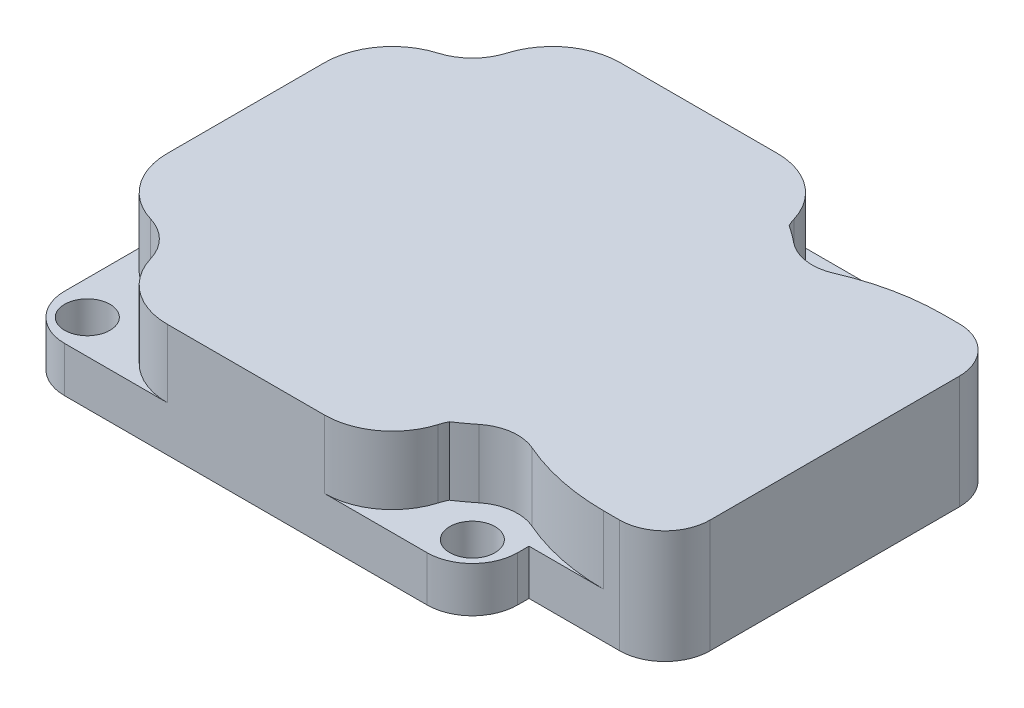
from build123d import *

# Parameters (mm, degrees)
BOSS_EXTRUDE1_DEPTH     = 5
SKETCH2_R               = 1
CUT_EXTRUDE1_DEPTH      = 15
SHELL1_DEPTH            = 3.5
SKETCH4_R               = 2.25
CUT_EXTRUDE2_DEPTH      = 3
FILLET2_R               = 3
BOSS_EXTRUDE2_DEPTH     = 5
CUT_EXTRUDE3_DEPTH      = 3.5
SKETCH8_W               = 3.515564437
SKETCH8_H               = 15
BOSS_EXTRUDE3_DEPTH     = 3
SKETCH9_R               = 2
CUT_EXTRUDE5_DEPTH      = 3
FILLET3_R               = 10
CUT_EXTRUDE7_DEPTH      = 3
CUT_EXTRUDE7_DEPTH_BACK = 1.5
BOSS_EXTRUDE4_START     = 3.5
BOSS_EXTRUDE4_DEPTH     = 3.5


with BuildPart() as part:
    # Sketch1 → Boss-Extrude1 (new body)
    with BuildSketch(Plane(origin=(0, 0, 0), x_dir=(1, 0, 0), z_dir=(0, 1, 0))):
        with BuildLine():
            Line((-8, 10), (8, 10))
            ThreePointArc((8, 10), (9.414213562, 9.414213562), (10, 8))
            Line((10, 8), (10, -8))
            ThreePointArc((10, -8), (9.414213562, -9.414213562), (8, -10))
            Line((8, -10), (-8, -10))
            ThreePointArc((-8, -10), (-9.414213562, -9.414213562), (-10, -8))
            Line((-10, -8), (-10, 8))
            ThreePointArc((-10, 8), (-9.414213562, 9.414213562), (-8, 10))
        make_face()
    extrude(amount=BOSS_EXTRUDE1_DEPTH)

    # Sketch2 → Cut-Extrude1 (cut)
    with BuildSketch(Plane.XZ):
        with Locations(Location((-8.5, 8.5, 0), (0, 0, 270))):
            Circle(SKETCH2_R)
        with Locations(Location((8.5, 8.5, 0), (0, 0, 270))):
            Circle(SKETCH2_R)
        with Locations(Location((8.5, -8.5, 0), (0, 0, 270))):
            Circle(SKETCH2_R)
        with Locations(Location((-8.5, -8.5, 0), (0, 0, 270))):
            Circle(SKETCH2_R)
    extrude(amount=-CUT_EXTRUDE1_DEPTH, mode=Mode.SUBTRACT)

    # Shell1: read off the stored shape, not the designer's step
    # Shell1 outline → Shell1 (cut)
    with BuildSketch(Plane(origin=(0, 0, 0), x_dir=(1, 0, 0), z_dir=(0, 1, 0))):
        with BuildLine():
            Line((6, 8.5), (-6, 8.5))
            ThreePointArc((-6, 8.5), (-6.732233047, 6.732233047), (-8.5, 6))
            Line((-8.5, 6), (-8.5, -6))
            ThreePointArc((-8.5, -6), (-6.732233047, -6.732233047), (-6, -8.5))
            Line((-6, -8.5), (6, -8.5))
            ThreePointArc((6, -8.5), (6.732233047, -6.732233047), (8.5, -6))
            Line((8.5, -6), (8.5, 6))
            ThreePointArc((8.5, 6), (6.732233047, 6.732233047), (6, 8.5))
        make_face()
    extrude(amount=SHELL1_DEPTH, mode=Mode.SUBTRACT)

    # Sketch4 → Cut-Extrude2 (cut)
    with BuildSketch(Plane(origin=(0, 5, 0), x_dir=(1, 0, 0), z_dir=(0, 1, 0))):
        with Locations((8.5, -8.5)):
            Circle(SKETCH4_R)
        with Locations((-8.5, -8.5)):
            Circle(SKETCH4_R)
        with Locations((-8.5, 8.5)):
            Circle(SKETCH4_R)
        with Locations((8.5, 8.5)):
            Circle(SKETCH4_R)
    extrude(amount=-CUT_EXTRUDE2_DEPTH, mode=Mode.SUBTRACT)

    # Fillet2
    fillet2_edges = [part.edges().sort_by_distance(p)[0] for p in [
        (6.822949017, 3.5, -10),
        (10, 3.5, -6.822949017),
        (-6.822949017, 3.5, -10),
        (-10, 3.5, -6.822949017),
        (-10, 3.5, 6.822949017),
        (-6.822949017, 3.5, 10),
        (6.822949017, 3.5, 10),
        (10, 3.5, 6.822949017),
    ]]
    fillet(fillet2_edges, radius=FILLET2_R)

    # Sketch5 → Boss-Extrude2 (add)
    with BuildSketch(Plane.XZ):
        with BuildLine():
            Line((10, 7.5), (14, 7.5))
            ThreePointArc((14, 7.5), (15.414213562, 6.914213562), (16, 5.5))
            Line((16, 5.5), (16, -5.5))
            ThreePointArc((16, -5.5), (15.414213562, -6.914213562), (14, -7.5))
            Line((14, -7.5), (10, -7.5))
            Line((10, -7.5), (10, 7.5))
        make_face()
    extrude(amount=-BOSS_EXTRUDE2_DEPTH)

    # Sketch6 → Cut-Extrude3 (cut)
    with BuildSketch(Plane.XZ):
        with BuildLine():
            Line((8.5, 5.5), (13, 5.5))
            ThreePointArc((13, 5.5), (14.060660172, 5.060660172), (14.5, 4))
            Line((14.5, 4), (14.5, -4))
            ThreePointArc((14.5, -4), (14.060660172, -5.060660172), (13, -5.5))
            Line((13, -5.5), (8.5, -5.5))
            Line((8.5, -5.5), (8.5, 5.5))
        make_face()
    extrude(amount=-CUT_EXTRUDE3_DEPTH, mode=Mode.SUBTRACT)

    # Sketch8 → Boss-Extrude3 (add)
    with BuildSketch(Plane(origin=(0, 5, 0), x_dir=(1, 0, 0), z_dir=(0, 1, 0))):
        with Locations((8.242217782, 0)):
            Rectangle(SKETCH8_W, SKETCH8_H)
    extrude(amount=-BOSS_EXTRUDE3_DEPTH)

    # Sketch9 → Cut-Extrude5 (cut)
    with BuildSketch(Plane(origin=(0, 5, 0), x_dir=(1, 0, 0), z_dir=(0, 1, 0))):
        with Locations((8.5, 8.5)):
            Circle(SKETCH9_R)
        with Locations((8.5, -8.5)):
            Circle(SKETCH9_R)
    extrude(amount=-CUT_EXTRUDE5_DEPTH, mode=Mode.SUBTRACT)

    # Fillet3
    # the kernel refuses this fillet: 10 mm, written as the material it takes off along each edge
    with BuildSketch(Plane(origin=(10.232050808, 2, -7.5), x_dir=(1, 0, 0), z_dir=(0, 1, 0))) as fillet3_piece_1:
        with BuildLine():
            CenterArc((3.063780716, -10), FILLET3_R, 90, 23.556464309)
            ThreePointArc((-0.932745554, -0.833333333), (-0.399552407, -0.491458351), (0, 0))
            Line((0, 0), (3.063780716, 0))
        make_face()
    extrude(amount=10.659451789, mode=Mode.SUBTRACT)
    with BuildSketch(Plane(origin=(6.767949192, 2, -7.5), x_dir=(0.649978972407837, 0, 0.759952192856664), z_dir=(0, 1, 0))) as fillet3_piece_2:
        with BuildLine():
            CenterArc((2.560910878, -9.831273909), FILLET3_R, 100.540016502, 5.393327967)
            Line((-0.184277898, -0.215456804), (0, 0))
            ThreePointArc((0, 0), (0.365844411, -0.033745218), (0.731688822, 0))
        make_face()
    extrude(amount=4.829222056, mode=Mode.SUBTRACT)
    with BuildSketch(Plane(origin=(10.232050808, 2, 7.5), x_dir=(-0.7457291752746819, 0, -0.6662492004829293), z_dir=(0, 1, 0))) as fillet3_piece_3:
        with BuildLine():
            CenterArc((4.377741338, -9.498533205), FILLET3_R, 108.221767845, 23.556464309)
            Line((-2.284750666, -2.041241452), (0, 0))
            ThreePointArc((0, 0), (0.62539162, -0.100293359), (1.25078324, 0))
        make_face()
    extrude(amount=10.659451789, mode=Mode.SUBTRACT)
    with BuildSketch(Plane(origin=(6.767949192, 2, 7.5), x_dir=(-1.0, 0, -2.3874717233974133e-11), z_dir=(0, 1, 0))) as fillet3_piece_4:
        with BuildLine():
            CenterArc((5.806759945, -8.33629115), FILLET3_R, 123.52663903, 5.393327967)
            ThreePointArc((-0.475582349, -0.556048525), (-0.212146422, -0.299957945), (0, 0))
            Line((0, 0), (0.28351363, 0))
        make_face()
    extrude(amount=4.829222056, mode=Mode.SUBTRACT)

    # Sketch10 → Cut-Extrude7 (cut, two sides: drawn at the far end of the back side and taken through both)
    with BuildSketch(Plane.XZ.offset(-2).offset(-CUT_EXTRUDE7_DEPTH_BACK)):
        with BuildLine():
            Line((8.5, 6), (13, 6))
            ThreePointArc((13, 6), (14.060660172, 5.560660172), (14.5, 4.5))
            Line((14.5, 4.5), (14.5, -4.5))
            ThreePointArc((14.5, -4.5), (14.060660172, -5.560660172), (13, -6))
            Line((13, -6), (8.5, -6))
            ThreePointArc((8.5, -6), (7.370298682, -6.269803835), (6.484435563, -7.020980054))
            Line((6.484435563, -7.020980054), (6.484435563, 7.020980054))
            ThreePointArc((6.484435563, 7.020980054), (7.392428114, 6.313490581), (8.5, 6))
        make_face()
    extrude(amount=CUT_EXTRUDE7_DEPTH + CUT_EXTRUDE7_DEPTH_BACK, mode=Mode.SUBTRACT)

    # Sketch11 → Boss-Extrude4 (add)
    with BuildSketch(Plane.XZ.offset(-3.5).offset(BOSS_EXTRUDE4_START)):
        with BuildLine():
            Line((4.951661673, -8.5), (6, -8.5))
            ThreePointArc((6, -8.5), (6.732233047, -6.732233047), (8.5, -6))
            Line((8.5, -6), (11.018075631, -6))
            ThreePointArc((11.018075631, -6), (7.148016159, -5.219322543), (4.951661673, -8.5))
        make_face()
        with BuildLine():
            Line((11.018075631, 6), (8.5, 6))
            ThreePointArc((8.5, 6), (6.798059889, 6.798059889), (6, 8.5))
            Line((6, 8.5), (4.951661673, 8.5))
            ThreePointArc((4.951661673, 8.5), (7.148016159, 5.219322543), (11.018075631, 6))
        make_face()
        with BuildLine():
            Line((-6, 8.5), (-5.487129131, 8.5))
            ThreePointArc((-5.487129131, 8.5), (-6.369578578, 6.369578578), (-8.5, 5.487129131))
            Line((-8.5, 5.487129131), (-8.5, 6))
            ThreePointArc((-8.5, 6), (-6.732233047, 6.732233047), (-6, 8.5))
        make_face()
        with BuildLine():
            Line((-8.5, -6), (-8.5, -5.487129131))
            ThreePointArc((-8.5, -5.487129131), (-6.365781058, -6.365781058), (-5.487129131, -8.5))
            Line((-5.487129131, -8.5), (-5.689784623, -8.747525568))
            Line((-5.689784623, -8.747525568), (-6, -8.5))
            ThreePointArc((-6, -8.5), (-6.728431484, -6.728431484), (-8.5, -6))
        make_face()
    extrude(amount=-BOSS_EXTRUDE4_DEPTH)


solid = part.part
